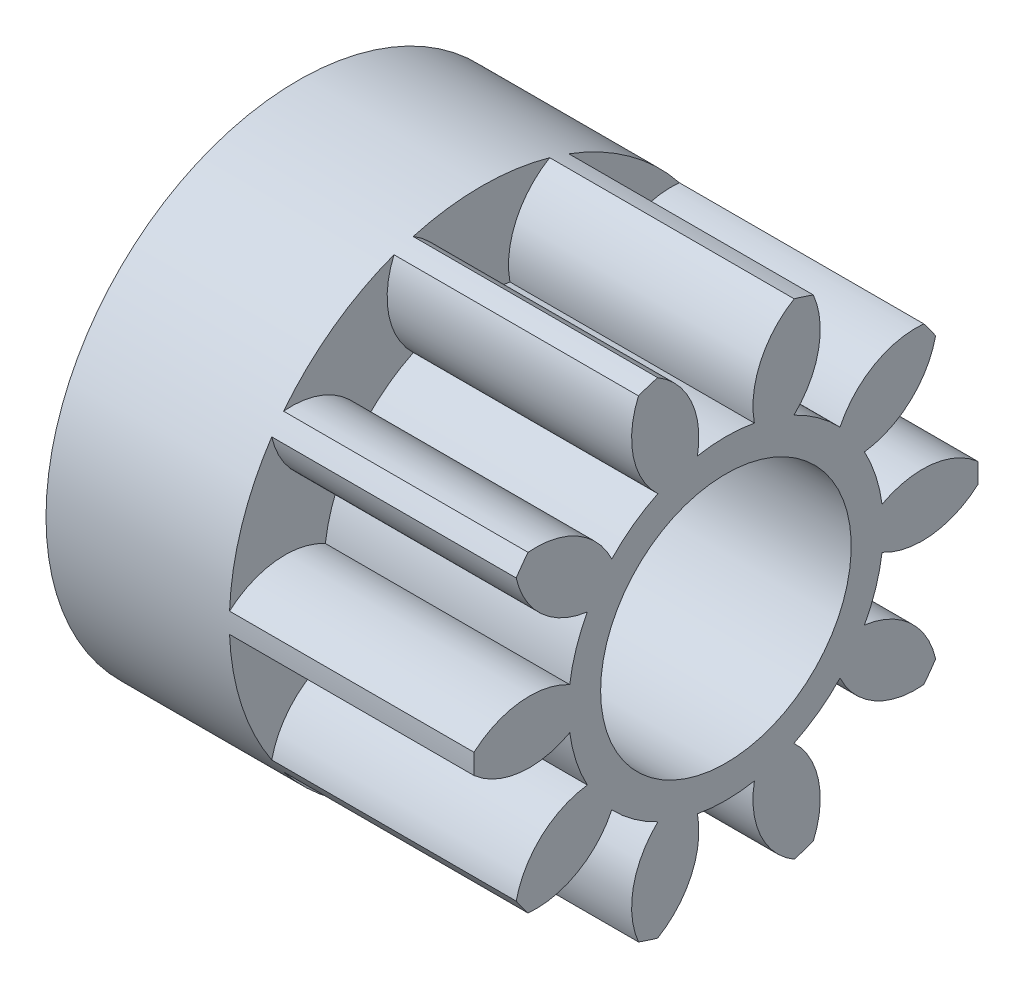
from build123d import *
from build123d.topology import SkipClean

# Parameters (mm, degrees)
BASPROSKE_W         = 8
BASPROSKE_H         = 8.25
TOOTHCUT_DEPTH      = 15.146554351
TEETHCUTS_COUNT     = 10
TEETHCUTS_ANGLE     = 324
BORSKE_R            = 4.1
BORE_DEPTH          = 50.0000508
SKETCH_1_R          = 8.25
SKETCH_1_R_2        = 4.1
EXTRUDE_3_DEPTH     = 6
SKETCH_2_R          = 1.5
CUT_EXTRUDE_1_DEPTH = 16


with BuildPart() as part:
    # BasProSke → Base-Revolve (revolve)
    with BuildSketch(Plane(origin=(0, 0, 0), x_dir=(1, 0, 0), z_dir=(0, 1, 0))):
        with Locations((4, 4.125)):
            Rectangle(BASPROSKE_W, BASPROSKE_H)
    revolve(axis=Axis((-10, 0, 0), (1, 0, 0)))

    # TooCutSke → ToothCut (cut, through all)
    with BuildSketch(Plane(origin=(0, 0, 0), x_dir=(0, 0, -1), z_dir=(1, 0, 0))):
        with BuildLine():
            ThreePointArc((0.931992048, 5.070305058), (0, 5.15525), (-0.931992048, 5.070305058))
            ThreePointArc((-0.931992048, 5.070305058), (-1.137854344, 6.727189108), (-2.264257491, 7.959609486))
            ThreePointArc((-2.264257491, 7.959609486), (0, 8.2754), (2.264257491, 7.959609486))
            ThreePointArc((2.264257491, 7.959609486), (1.137854344, 6.727189108), (0.931992048, 5.070305058))
        make_face()
    toothcut = extrude(amount=TOOTHCUT_DEPTH, mode=Mode.SUBTRACT)

    # TeethCuts: ToothCut ×10 about axis
    teethcuts_axis = Axis((-10, 0, 0), (1, 0, 0))
    for i in range(1, TEETHCUTS_COUNT):
        add(toothcut.rotate(teethcuts_axis, i * TEETHCUTS_ANGLE / (TEETHCUTS_COUNT - 1)), mode=Mode.SUBTRACT)

    # BorSke → Bore (cut, symmetric)
    with BuildSketch(Plane(origin=(0, 0, 0), x_dir=(0, 0, -1), z_dir=(1, 0, 0))):
        Circle(BORSKE_R)
    extrude(amount=BORE_DEPTH, both=True, mode=Mode.SUBTRACT)

    # 草图1 → 凸台-拉伸3 (add)
    with SkipClean():  # the faces are left unmerged after this step: merging them gives an invalid solid
        with BuildSketch(Plane.ZY):
            Circle(SKETCH_1_R)
            Circle(SKETCH_1_R_2, mode=Mode.SUBTRACT)
        extrude(amount=EXTRUDE_3_DEPTH)
    add(part.part.scale(1), mode=Mode.REPLACE)  # the faces are merged on a copy

    # 草图2 → 切除-拉伸1 (cut)
    with BuildSketch(Plane(origin=(0, 0, 0), x_dir=(1, 0, 0), z_dir=(0, 1, 0))):
        with Locations((-3, 0)):
            Circle(SKETCH_2_R)
    extrude(amount=-CUT_EXTRUDE_1_DEPTH, mode=Mode.SUBTRACT)


solid = part.part
